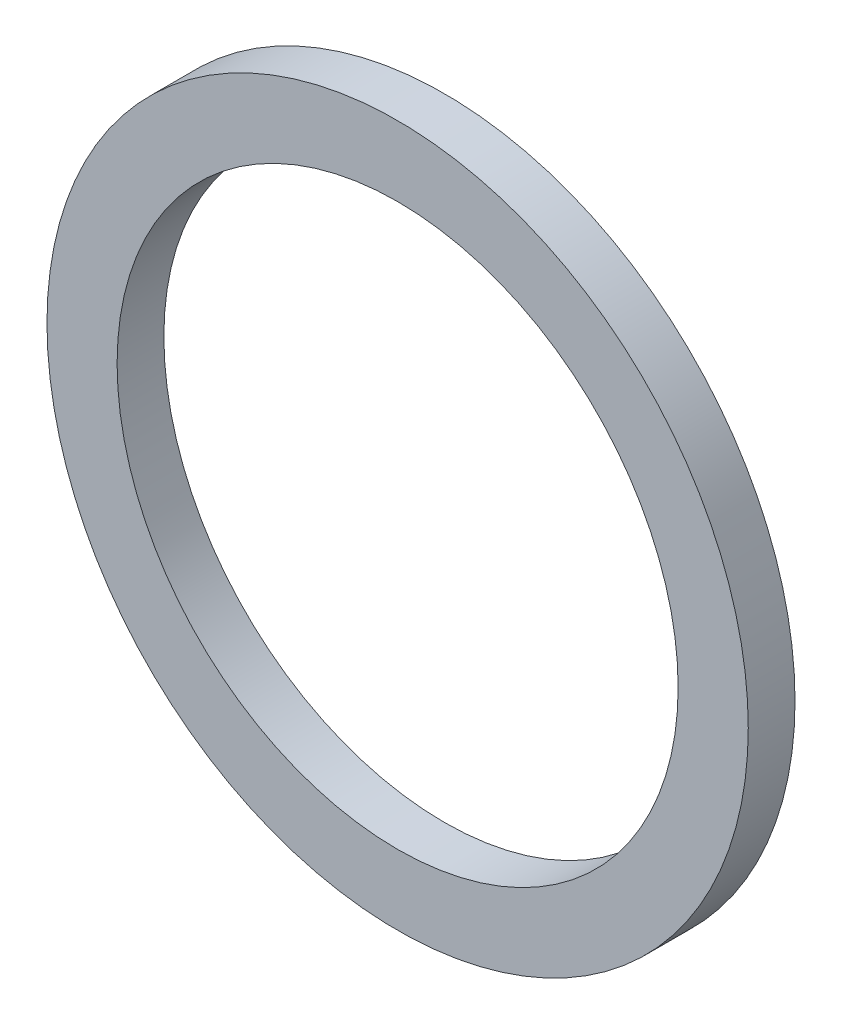
from build123d import *

# Parameters (mm, degrees)
BOSS_EXTRU_1_OUTLINE_R  = 15
BOSS_EXTRU_1_DEPTH      = 2
ESQUISSE2_R             = 12
ENL_V_MAT_EXTRU_1_DEPTH = 22.307275753


# Read off the part's stored shape, not the designer's step: Boss.-Extru.1
with BuildPart() as part:
    # Boss.-Extru.1 outline → Boss.-Extru.1 (new body)
    with BuildSketch(Plane.XY):
        Circle(BOSS_EXTRU_1_OUTLINE_R)
    extrude(amount=BOSS_EXTRU_1_DEPTH)

    # Esquisse2 → Enlèv. mat.-Extru.1 (cut, through all)
    with BuildSketch(Plane.XY.offset(2)):
        Circle(ESQUISSE2_R)
    extrude(amount=-ENL_V_MAT_EXTRU_1_DEPTH, mode=Mode.SUBTRACT)


solid = part.part
